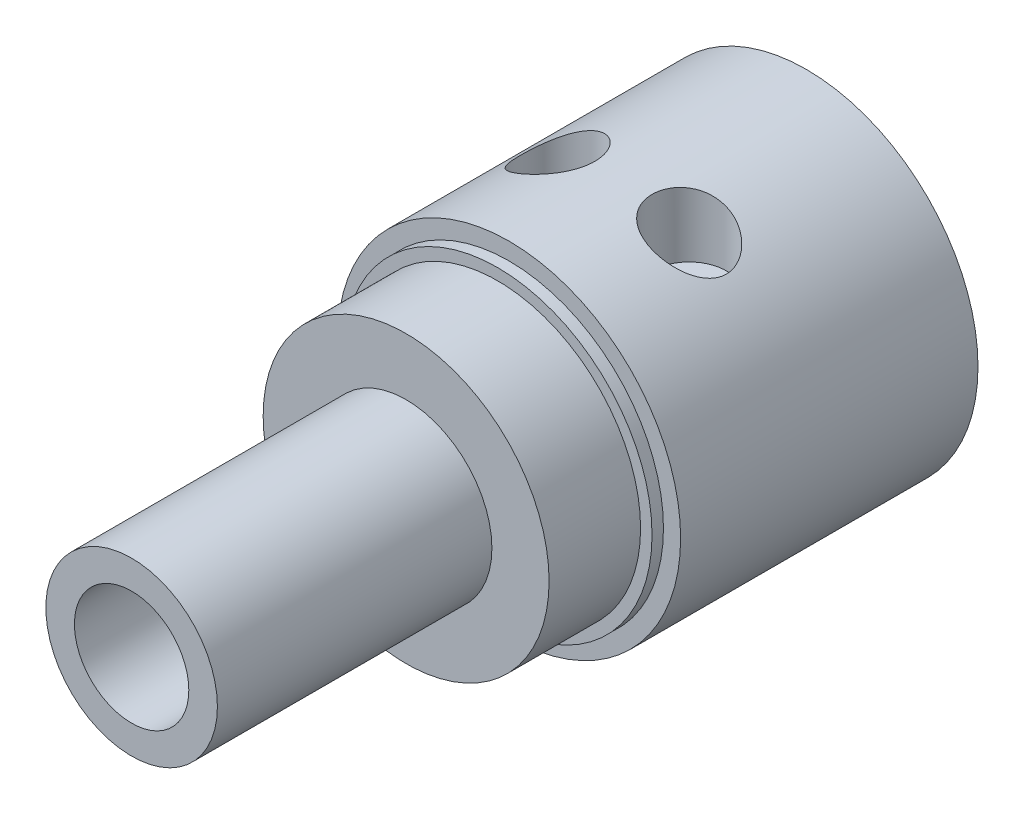
from build123d import *

# Parameters (mm, degrees)
SKETCH1_R                      = 15
BOSS_EXTRUDE1_DEPTH            = 35
SKETCH2_OUTSIDE_W              = 43
SKETCH2_OUTSIDE_H              = 43
SKETCH2_OUTSIDE_R              = 13.5
CUT_EXTRUDE1_DEPTH             = 9
SKETCH3_OUTSIDE_W              = 43
SKETCH3_OUTSIDE_H              = 43
SKETCH3_OUTSIDE_R              = 12.5
CUT_EXTRUDE2_DEPTH             = 8
SKETCH4_R                      = 8.25
CUT_EXTRUDE3_DEPTH             = 11
CBORE_FOR_M3_SHCS1_D           = 3.4
CBORE_FOR_M3_SHCS1_CBORE_D     = 6.5
CBORE_FOR_M3_SHCS1_CBORE_DEPTH = 6
SKETCH7_R                      = 7.5
BOSS_EXTRUDE2_DEPTH            = 24
SKETCH8_R                      = 5
CUT_EXTRUDE4_DEPTH             = 63.6976875


with BuildPart() as part:
    # Sketch1 → Boss-Extrude1 (new body)
    with BuildSketch(Plane.XY):
        Circle(SKETCH1_R)
    extrude(amount=BOSS_EXTRUDE1_DEPTH)

    # Sketch2 outside → Cut-Extrude1 (cut)
    with BuildSketch(Plane.XY.offset(35)):
        Rectangle(SKETCH2_OUTSIDE_W, SKETCH2_OUTSIDE_H)
        Circle(SKETCH2_OUTSIDE_R, mode=Mode.SUBTRACT)
    extrude(amount=-CUT_EXTRUDE1_DEPTH, mode=Mode.SUBTRACT)

    # Sketch3 outside → Cut-Extrude2 (cut)
    with BuildSketch(Plane.XY.offset(35)):
        Rectangle(SKETCH3_OUTSIDE_W, SKETCH3_OUTSIDE_H)
        Circle(SKETCH3_OUTSIDE_R, mode=Mode.SUBTRACT)
    extrude(amount=-CUT_EXTRUDE2_DEPTH, mode=Mode.SUBTRACT)

    # Sketch4 → Cut-Extrude3 (cut)
    with BuildSketch(Plane(origin=(0, 0, 0), x_dir=(-1, 0, 0), z_dir=(0, 0, -1))):
        Circle(SKETCH4_R)
    extrude(amount=-CUT_EXTRUDE3_DEPTH, mode=Mode.SUBTRACT)

    # CBORE for M3 SHCS1 (through all)
    with Locations(Plane(origin=(0, 15, 0), x_dir=(1, 0, 0), z_dir=(0, 1, 0))):
        with Locations((-5.75, -16), (5.75, -16)):
            CounterBoreHole(CBORE_FOR_M3_SHCS1_D / 2, CBORE_FOR_M3_SHCS1_CBORE_D / 2, CBORE_FOR_M3_SHCS1_CBORE_DEPTH)

    # Sketch7 → Boss-Extrude2 (add)
    with BuildSketch(Plane.XY.offset(35)):
        Circle(SKETCH7_R)
    extrude(amount=BOSS_EXTRUDE2_DEPTH)

    # Sketch8 → Cut-Extrude4 (cut, through all)
    with BuildSketch(Plane.XY.offset(59)):
        Circle(SKETCH8_R)
    extrude(amount=-CUT_EXTRUDE4_DEPTH, mode=Mode.SUBTRACT)


solid = part.part
